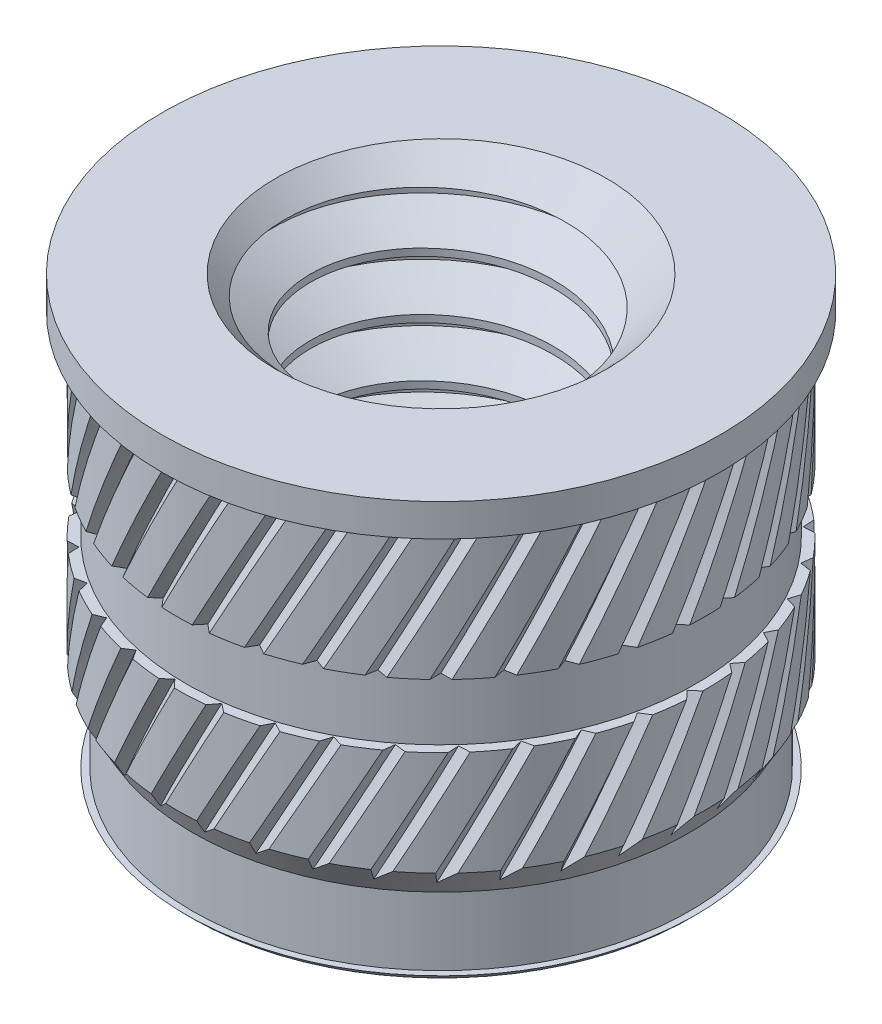
from build123d import *

# Parameters (mm, degrees)
SKETCH1_R         = 1.945
EXTRUDE1_DEPTH    = 3.4
SKETCH1_4_R       = 2.07
EXTRUDE2_DEPTH    = 2.601346
SKETCH1_3_R       = 2.185
EXTRUDE3_DEPTH    = 0.254
SKETCH2_R         = 2.07
EXTRUDE4_DEPTH    = 0.216506
EXTRUDE4_TAPER    = 30
SKETCH8_R         = 0.957716426
EXTRUDE6_DEPTH    = 3.4
CHAMFER1_SIZE     = 0.3375
CUT_SWEEP1_PITCH  = 0.45
CUT_SWEEP2_PITCH  = 24.7725
CIRPATTERN1_COUNT = 36
SKETCH11_W        = 0.19
SKETCH11_H        = 0.49545


with BuildPart() as part:
    # Sketch1 → Extrude1 (new body)
    with BuildSketch(Plane(origin=(0, 0, 0), x_dir=(1, 0, 0), z_dir=(0, 1, 0))):
        with Locations(Location((0, 0, 0), (0, 0, 270))):
            Circle(SKETCH1_R)
    extrude(amount=-EXTRUDE1_DEPTH)

    # Sketch1<4> → Extrude2 (add)
    with BuildSketch(Plane(origin=(0, 0, 0), x_dir=(1, 0, 0), z_dir=(0, 1, 0))):
        with Locations(Location((0, 0, 0), (0, 0, 270))):
            Circle(SKETCH1_4_R)
    extrude(amount=-EXTRUDE2_DEPTH)

    # Sketch1<3> → Extrude3 (add)
    with BuildSketch(Plane(origin=(0, 0, 0), x_dir=(1, 0, 0), z_dir=(0, 1, 0))):
        with Locations(Location((0, 0, 0), (0, 0, 270))):
            Circle(SKETCH1_3_R)
    extrude(amount=-EXTRUDE3_DEPTH)

    # Sketch2 → Extrude4 (add)
    with BuildSketch(Plane.XZ.offset(2.601346189)):
        with Locations(Location((0, 0, 0), (0, 0, 90))):
            Circle(SKETCH2_R)
    extrude(amount=EXTRUDE4_DEPTH, taper=EXTRUDE4_TAPER)

    # Extrude5: read off the stored shape, not the designer's step
    # Extrude5 outline → Extrude5 (revolve)
    with BuildSketch(Plane.XY):
        Polygon((1.945, -3.35), (1.945, -3.4), (1.995, -3.35), align=None)
    revolve(axis=Axis((0, 0, 0), (0, 1, 0)))

    # Sketch8 → Extrude6 (cut)
    with BuildSketch(Plane(origin=(0, 0, 0), x_dir=(1, 0, 0), z_dir=(0, 1, 0))):
        with Locations(Location((0, 0, 0), (0, 0, 270))):
            Circle(SKETCH8_R)
    extrude(amount=-EXTRUDE6_DEPTH, mode=Mode.SUBTRACT)

    # Chamfer1
    chamfer1_edges = [part.edges().sort_by_distance(p)[0] for p in [
        (0, -3.4, -0.957716426),
        (0, 0, -0.957716426),
    ]]
    chamfer(chamfer1_edges, length=CHAMFER1_SIZE)

    # Cut-Sweep1: arcs per turn and ends read off the stored shape
    # Cut-Sweep1: the profile of Sketch7 screwed along a right-hand helix through 9.253687 turns, 6 arcs to a turn; built about Z, then put on its axis
    cut_sweep1_z = Axis((0, 0, 0), (0, 0, 1))
    cut_sweep1_corners = [(1.25, 0, -0.225), (1.25, 0, -0.16875), (0.933359462, 0, 0.0140625), (0.933359462, 0, -0.4078125)]
    with BuildLine(mode=Mode.PRIVATE) as cut_sweep1_profile:
        Line(cut_sweep1_corners[0], cut_sweep1_corners[1])
        Line(cut_sweep1_corners[1], cut_sweep1_corners[2])
        Line(cut_sweep1_corners[2], cut_sweep1_corners[3])
        Line(cut_sweep1_corners[3], cut_sweep1_corners[0])
    cut_sweep1_cap = Face(cut_sweep1_profile.wire())
    cut_sweep1_turn_angles = [0, 30, 60, 90, 120, 150, 180, 210, 240, 270, 300, 330, 360]
    cut_sweep1_turn_weights = [1, 0.8660254037844387, 1, 0.8660254037844387, 1, 0.8660254037844387, 1, 0.8660254037844387, 1, 0.8660254037844387, 1, 0.8660254037844387, 1]
    cut_sweep1_turn_rails = [Edge.make_bspline([Vector(p[0], p[1], 0).rotate(cut_sweep1_z, cut_sweep1_turn_angles[k]) / cut_sweep1_turn_weights[k] + Vector(0, 0, p[2] + CUT_SWEEP1_PITCH * cut_sweep1_turn_angles[k] / 360) for k in range(13)], [0, 0, 0, 1, 1, 2, 2, 3, 3, 4, 4, 5, 5, 6, 6, 6], 2, cut_sweep1_turn_weights) for p in cut_sweep1_corners]
    cut_sweep1_turn_sides = [Face.make_surface_from_curves(cut_sweep1_turn_rails[p[0]], cut_sweep1_turn_rails[p[1]]) for p in [(0, 1), (1, 2), (2, 3), (3, 0)]]
    cut_sweep1_last_angles = [3240, 3270, 3300, 3315.663706144, 3331.327412287]
    cut_sweep1_last_weights = [1, 0.8660254037844387, 1, 0.9628629643922332, 1]
    cut_sweep1_last_rails = [Edge.make_bspline([Vector(p[0], p[1], 0).rotate(cut_sweep1_z, cut_sweep1_last_angles[k]) / cut_sweep1_last_weights[k] + Vector(0, 0, p[2] + CUT_SWEEP1_PITCH * cut_sweep1_last_angles[k] / 360) for k in range(5)], [0, 0, 0, 1, 1, 2, 2, 2], 2, cut_sweep1_last_weights) for p in cut_sweep1_corners]
    cut_sweep1_last_sides = [Face.make_surface_from_curves(cut_sweep1_last_rails[p[0]], cut_sweep1_last_rails[p[1]]) for p in [(0, 1), (1, 2), (2, 3), (3, 0)]]
    cut_sweep1 = Plane(origin=(0, 0, 0), x_dir=(-1, 0, 0), z_dir=(0, -1, 0)) * Solid(Shell([*[p.moved(Location((0, 0, CUT_SWEEP1_PITCH * i))) for i in range(9) for p in cut_sweep1_turn_sides], *cut_sweep1_last_sides, cut_sweep1_cap, cut_sweep1_cap.rotate(cut_sweep1_z, 3331.327412287).moved(Location((0, 0, CUT_SWEEP1_PITCH * 3331.327412287 / 360)))]))
    add(cut_sweep1, mode=Mode.SUBTRACT)

    # Cut-Sweep2: arcs per turn and ends read off the stored shape
    # Cut-Sweep2: the profile of Sketch10 screwed along a right-hand helix through 0.1 turns, 22 arcs to a turn; built about Z, then put on its axis
    cut_sweep2_z = Axis((0, 0, 0), (0, 0, 1))
    cut_sweep2_corners = [(2.0075, 0, 0), (2.07, 0.0625, 0), (2.07, -0.0625, 0)]
    with BuildLine(mode=Mode.PRIVATE) as cut_sweep2_profile:
        Line(cut_sweep2_corners[0], cut_sweep2_corners[1])
        Line(cut_sweep2_corners[1], cut_sweep2_corners[2])
        Line(cut_sweep2_corners[2], cut_sweep2_corners[0])
    cut_sweep2_cap = Face(cut_sweep2_profile.wire())
    cut_sweep2_turn_angles = [0, 8.181818182, 16.363636364, 24.545454545, 32.727272727, 34.363636364, 36]
    cut_sweep2_turn_weights = [1, 0.9898214418809327, 1, 0.9898214418809327, 1, 0.9995921928281892, 1]
    cut_sweep2_turn_rails = [Edge.make_bspline([Vector(p[0], p[1], 0).rotate(cut_sweep2_z, cut_sweep2_turn_angles[k]) / cut_sweep2_turn_weights[k] + Vector(0, 0, p[2] + CUT_SWEEP2_PITCH * cut_sweep2_turn_angles[k] / 360) for k in range(7)], [0, 0, 0, 1, 1, 2, 2, 3, 3, 3], 2, cut_sweep2_turn_weights) for p in cut_sweep2_corners]
    cut_sweep2_turn_sides = [Face.make_surface_from_curves(cut_sweep2_turn_rails[p[0]], cut_sweep2_turn_rails[p[1]]) for p in [(0, 1), (1, 2), (2, 0)]]
    cut_sweep2 = Plane(origin=(0, -0.254, 0), x_dir=(0, 0, 1), z_dir=(0, -1, 0)) * Solid(Shell([*cut_sweep2_turn_sides, cut_sweep2_cap, cut_sweep2_cap.rotate(cut_sweep2_z, 36).moved(Location((0, 0, CUT_SWEEP2_PITCH * 36 / 360)))]))
    add(cut_sweep2, mode=Mode.SUBTRACT)

    # CirPattern1: Cut-Sweep2 ×36 about axis
    cirpattern1_axis = Axis((0, -2.601346189, 0), (0, 1, 0))
    for i in range(1, CIRPATTERN1_COUNT):
        add(cut_sweep2.rotate(cirpattern1_axis, i * 360 / CIRPATTERN1_COUNT), mode=Mode.SUBTRACT)

    # Sketch11 → Cut-Revolve1 (revolve, cut)
    with BuildSketch(Plane.XY):
        with Locations((-2.09, -1.53592627)):
            Rectangle(SKETCH11_W, SKETCH11_H)
    revolve(axis=Axis((0, 0, 0), (0, -1, 0)), mode=Mode.SUBTRACT)


solid = part.part
